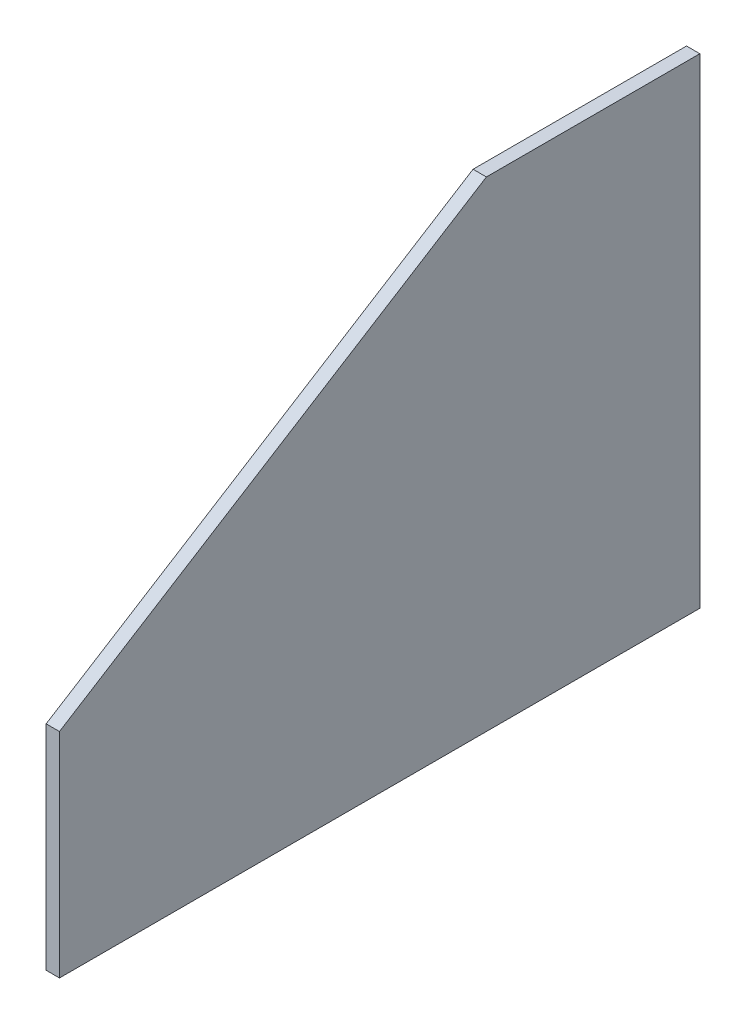
from build123d import *

# Parameters (mm, degrees)
BOSS_EXTRUDE1_DEPTH = 3.175


with BuildPart() as part:
    # Sketch1 → Boss-Extrude1 (new body)
    with BuildSketch(Plane(origin=(0, 0, 0), x_dir=(0, 0, -1), z_dir=(1, 0, 0))):
        Polygon((0, 0), (0, 114.3), (-50.8, 114.3), (-152.4, 50.8), (-152.4, 0), align=None)
    extrude(amount=BOSS_EXTRUDE1_DEPTH)


solid = part.part
